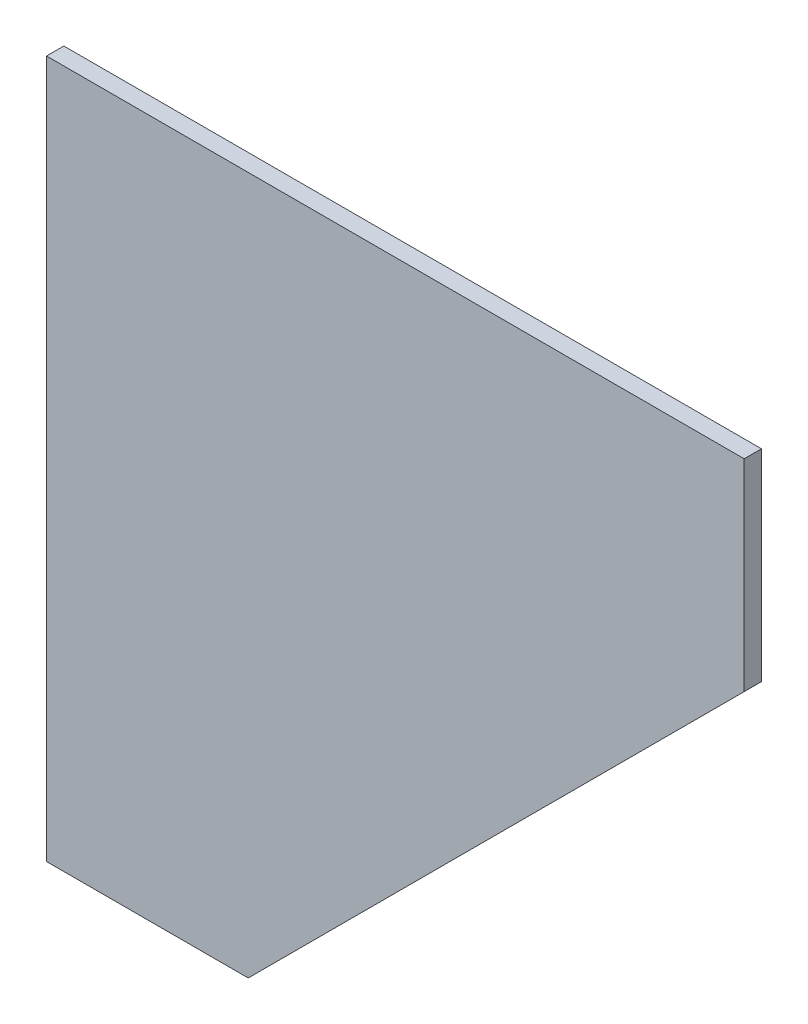
from build123d import *

# Parameters (mm, degrees)
SM_BASE_FLANGE_1_DEPTH = 6


# Sheet-metal steps are written as plain solids
with BuildPart() as part:
    # Sketch 1 → Базовая кромка1 (new body)
    with BuildSketch(Plane.XY):
        Polygon((292.132034356, -50), (50, -50), (50, -292.132034356), (120, -292.132034356), (292.132034356, -120), align=None)
    extrude(amount=-SM_BASE_FLANGE_1_DEPTH)


solid = part.part
